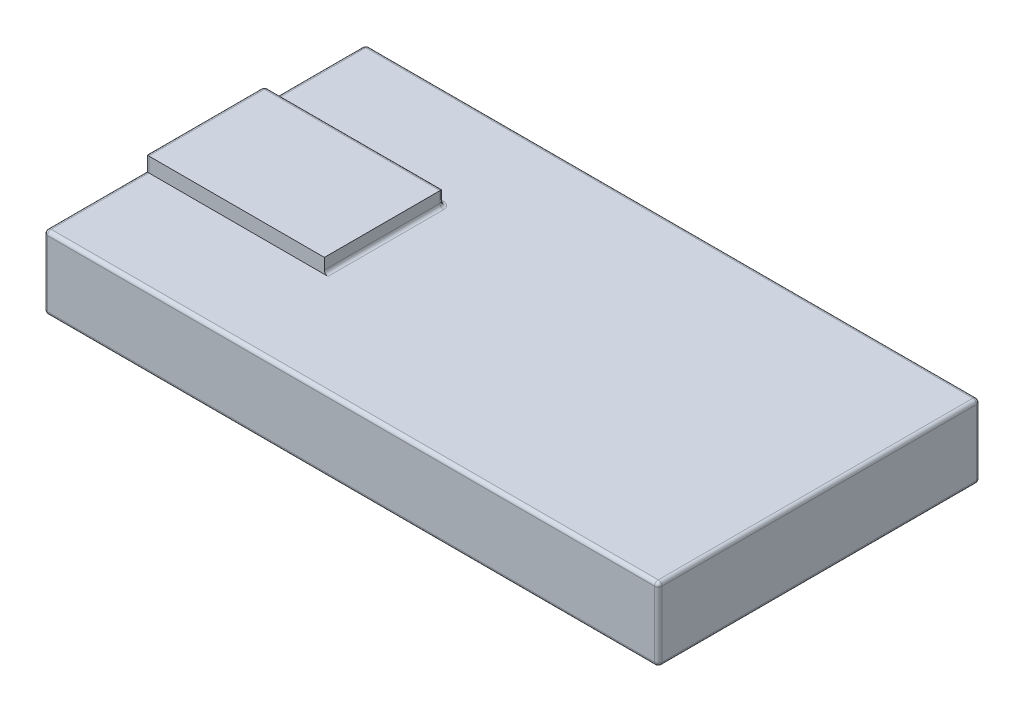
from build123d import *

# Parameters (mm, degrees)
SKETCH_1_W      = 84
SKETCH_1_H      = 44
EXTRUDE_1_DEPTH = 10
SKETCH_3_W      = 24.5
SKETCH_3_H      = 16.3
EXTRUDE_2_DEPTH = 2
FILLET_1_R      = 0.5
FILLET_2_R      = 0.5
FILLET_3_R      = 0.5


with BuildPart() as part:
    # 草图1 → 凸台-拉伸1 (new body)
    with BuildSketch(Plane(origin=(0, 0, 0), x_dir=(1, 0, 0), z_dir=(0, 1, 0))):
        Rectangle(SKETCH_1_W, SKETCH_1_H)
    extrude(amount=EXTRUDE_1_DEPTH)

    # 草图3 → 凸台-拉伸2 (add)
    with BuildSketch(Plane(origin=(0, 10, 0), x_dir=(1, 0, 0), z_dir=(0, 1, 0))):
        with Locations((-29.75, 0)):
            Rectangle(SKETCH_3_W, SKETCH_3_H)
    extrude(amount=EXTRUDE_2_DEPTH)

    # 圆角1
    fillet_1_edges = [part.edges().sort_by_distance(p)[0] for p in [
        (42, 10, 0),
    ]]
    fillet(fillet_1_edges, radius=FILLET_1_R)

    # 圆角2
    fillet_2_edges = [part.edges().sort_by_distance(p)[0] for p in [
        (-0.25, 10, 22),
        (42, 4.75, 22),
        (41.853553391, 9.853553391, 22),
        (0, 0, 22),
    ]]
    fillet(fillet_2_edges, radius=FILLET_2_R)

    # 圆角3
    # the kernel refuses this fillet: 0.5 mm, written as the material it takes off along each edge
    with BuildSketch(Plane(origin=(41.5, 0.5, 21.5), x_dir=(0, -1, 0), z_dir=(1, 0, 0))) as fillet_3_piece_1_section:
        Polygon((0, 0), (FILLET_3_R, 0), (FILLET_3_R, -FILLET_3_R), (0, -FILLET_3_R), align=None)
    fillet_3_piece_1 = extrude(amount=FILLET_3_R, mode=Mode.PRIVATE)
    fillet_3_piece_1 = fillet_3_piece_1 - Plane(origin=(41.5, 0.5, 21.5), x_dir=(0, 0.7071067811865475, -0.7071067811865475), z_dir=(1, 0, 0)) * Sphere(FILLET_3_R, mode=Mode.PRIVATE)
    add(fillet_3_piece_1, mode=Mode.SUBTRACT)
    with BuildSketch(Plane(origin=(41.5, 0.5, -21.5), x_dir=(0, 0, -1), z_dir=(1, 0, 0))) as fillet_3_piece_2_section:
        Polygon((0, 0), (FILLET_3_R, 0), (FILLET_3_R, -FILLET_3_R), (0, -FILLET_3_R), align=None)
    fillet_3_piece_2 = extrude(amount=FILLET_3_R, mode=Mode.PRIVATE)
    fillet_3_piece_2 = fillet_3_piece_2 - Plane(origin=(41.5, 0.5, -21.5), x_dir=(0, 0.7071067811865475, 0.7071067811865475), z_dir=(1, 0, 0)) * Sphere(FILLET_3_R, mode=Mode.PRIVATE)
    add(fillet_3_piece_2, mode=Mode.SUBTRACT)
    with BuildSketch(Plane(origin=(-41.5, 0.5, -21.5), x_dir=(0, 0, -1), z_dir=(-1, 0, 0))) as fillet_3_piece_3_section:
        Polygon((0, 0), (FILLET_3_R, 0), (FILLET_3_R, FILLET_3_R), (0, FILLET_3_R), align=None)
    fillet_3_piece_3 = extrude(amount=FILLET_3_R, mode=Mode.PRIVATE)
    fillet_3_piece_3 = fillet_3_piece_3 - Plane(origin=(-41.5, 0.5, -21.5), x_dir=(0, 0.7071067811865475, 0.7071067811865475), z_dir=(-1, 0, 0)) * Sphere(FILLET_3_R, mode=Mode.PRIVATE)
    add(fillet_3_piece_3, mode=Mode.SUBTRACT)
    with BuildSketch(Plane(origin=(-42, 10, 21.5), x_dir=(1, 0, 0), z_dir=(0, 0, -1))) as fillet_3_piece_4:
        with BuildLine():
            CenterArc((FILLET_3_R, FILLET_3_R), FILLET_3_R, 180, 90)
            Line((0, FILLET_3_R), (0, 0))
            Line((0, 0), (FILLET_3_R, 0))
        make_face()
    extrude(amount=13.35, mode=Mode.SUBTRACT)
    with BuildSketch(Plane(origin=(-42, 10, 8.15), x_dir=(0, 0, -1), z_dir=(0, 1, 0))) as fillet_3_piece_5:
        with BuildLine():
            CenterArc((FILLET_3_R, -FILLET_3_R), FILLET_3_R, 90, 90)
            Line((0, -FILLET_3_R), (0, 0))
            Line((0, 0), (FILLET_3_R, 0))
        make_face()
    extrude(amount=3.25, mode=Mode.SUBTRACT)
    with BuildSketch(Plane(origin=(-17.5, 10, -8.15), x_dir=(-1, 0, 0), z_dir=(0, 1, 0))) as fillet_3_piece_6:
        with BuildLine():
            CenterArc((FILLET_3_R, FILLET_3_R), FILLET_3_R, 180, 90)
            Line((0, FILLET_3_R), (0, 0))
            Line((0, 0), (FILLET_3_R, 0))
        make_face()
    extrude(amount=3.25, mode=Mode.SUBTRACT)
    with BuildSketch(Plane(origin=(-42, 12, -9.4), x_dir=(0, -1, 0), z_dir=(0, 0, 1))) as fillet_3_piece_7:
        with BuildLine():
            CenterArc((FILLET_3_R, FILLET_3_R), FILLET_3_R, 180, 90)
            Line((0, FILLET_3_R), (0, 0))
            Line((0, 0), (FILLET_3_R, 0))
        make_face()
    extrude(amount=18.8, mode=Mode.SUBTRACT)
    with BuildSketch(Plane(origin=(-16.25, 12, -8.15), x_dir=(0, -1, 0), z_dir=(-1, 0, 0))) as fillet_3_piece_8:
        with BuildLine():
            CenterArc((FILLET_3_R, FILLET_3_R), FILLET_3_R, 180, 90)
            Line((0, FILLET_3_R), (0, 0))
            Line((0, 0), (FILLET_3_R, 0))
        make_face()
    extrude(amount=27, mode=Mode.SUBTRACT)
    with BuildSketch(Plane(origin=(-43.25, 10, -22), x_dir=(0, -1, 0), z_dir=(1, 0, 0))) as fillet_3_piece_9:
        with BuildLine():
            CenterArc((FILLET_3_R, -FILLET_3_R), FILLET_3_R, 90, 90)
            Line((0, -FILLET_3_R), (0, 0))
            Line((0, 0), (FILLET_3_R, 0))
        make_face()
    extrude(amount=84.75, mode=Mode.SUBTRACT)
    with BuildSketch(Plane(origin=(42, 0.5, -22), x_dir=(0, 0, 1), z_dir=(0, 1, 0))) as fillet_3_piece_10:
        with BuildLine():
            CenterArc((FILLET_3_R, -FILLET_3_R), FILLET_3_R, 90, 90)
            Line((0, -FILLET_3_R), (0, 0))
            Line((0, 0), (FILLET_3_R, 0))
        make_face()
    extrude(amount=9, mode=Mode.SUBTRACT)
    with BuildSketch(Plane(origin=(41.5, 9.5, -22), x_dir=(1, 0, 0), z_dir=(0, -1, 0))) as fillet_3_piece_11:
        with BuildLine():
            CenterArc((0.5 - FILLET_3_R, FILLET_3_R), FILLET_3_R, 270, 90)
            Line((0.5 - FILLET_3_R, 0), (0.5, 0))
            Line((0.5, 0), (0.5, FILLET_3_R))
        make_face()
    revolve(axis=Axis((41.5, 9.5, -22), (0, 0, 1)), revolution_arc=90, mode=Mode.SUBTRACT)
    with BuildSketch(Plane(origin=(42, 0, -21.5), x_dir=(0, 1, 0), z_dir=(0, 0, 1))) as fillet_3_piece_12:
        with BuildLine():
            CenterArc((FILLET_3_R, FILLET_3_R), FILLET_3_R, 180, 90)
            Line((0, FILLET_3_R), (0, 0))
            Line((0, 0), (FILLET_3_R, 0))
        make_face()
    extrude(amount=43, mode=Mode.SUBTRACT)
    with BuildSketch(Plane(origin=(-42, 0.5, 22), x_dir=(1, 0, 0), z_dir=(0, 1, 0))) as fillet_3_piece_13:
        with BuildLine():
            CenterArc((FILLET_3_R, FILLET_3_R), FILLET_3_R, 180, 90)
            Line((0, FILLET_3_R), (0, 0))
            Line((0, 0), (FILLET_3_R, 0))
        make_face()
    extrude(amount=9, mode=Mode.SUBTRACT)
    with BuildSketch(Plane(origin=(-42, 0.5, 21.5), x_dir=(0, -1, 0), z_dir=(0, 0, -1))) as fillet_3_piece_14:
        with BuildLine():
            CenterArc((0.5 - FILLET_3_R, -FILLET_3_R), FILLET_3_R, 0, 90)
            Line((0.5 - FILLET_3_R, 0), (0.5, 0))
            Line((0.5, 0), (0.5, -FILLET_3_R))
        make_face()
    revolve(axis=Axis((-42, 0.5, 21.5), (-1, 0, 0)), revolution_arc=90, mode=Mode.SUBTRACT)
    with BuildSketch(Plane(origin=(-42, 9.5, 21.5), x_dir=(0, 1, 0), z_dir=(0, 0, -1))) as fillet_3_piece_15:
        with BuildLine():
            CenterArc((0.5 - FILLET_3_R, FILLET_3_R), FILLET_3_R, 270, 90)
            Line((0.5, FILLET_3_R), (0.5, 0))
            Line((0.5, 0), (0.5 - FILLET_3_R, 0))
        make_face()
    revolve(axis=Axis((-42, 9.5, 21.5), (1, 0, 0)), revolution_arc=90, mode=Mode.SUBTRACT)
    with BuildSketch(Plane(origin=(-42, 0, 21.5), x_dir=(1, 0, 0), z_dir=(0, 0, -1))) as fillet_3_piece_16:
        with BuildLine():
            CenterArc((FILLET_3_R, -FILLET_3_R), FILLET_3_R, 90, 90)
            Line((0, -FILLET_3_R), (0, 0))
            Line((0, 0), (FILLET_3_R, 0))
        make_face()
    extrude(amount=43, mode=Mode.SUBTRACT)
    with BuildSketch(Plane(origin=(-41.5, 0, -22), x_dir=(0, 1, 0), z_dir=(1, 0, 0))) as fillet_3_piece_17:
        with BuildLine():
            CenterArc((FILLET_3_R, FILLET_3_R), FILLET_3_R, 180, 90)
            Line((0, FILLET_3_R), (0, 0))
            Line((0, 0), (FILLET_3_R, 0))
        make_face()
    extrude(amount=83, mode=Mode.SUBTRACT)
    with BuildSketch(Plane(origin=(-42, 0.5, -22), x_dir=(1, 0, 0), z_dir=(0, 1, 0))) as fillet_3_piece_18:
        with BuildLine():
            CenterArc((FILLET_3_R, -FILLET_3_R), FILLET_3_R, 90, 90)
            Line((0, -FILLET_3_R), (0, 0))
            Line((0, 0), (FILLET_3_R, 0))
        make_face()
    extrude(amount=10.75, mode=Mode.SUBTRACT)
    with BuildSketch(Plane(origin=(-42, 10, 21.5), x_dir=(1, 0, 0), z_dir=(0, 0, -1))) as fillet_3_piece_19a_section:
        with BuildLine():
            CenterArc((FILLET_3_R, FILLET_3_R), FILLET_3_R, 180, 90)
            Line((0, FILLET_3_R), (0, 0))
            Line((0, 0), (FILLET_3_R, 0))
        make_face()
    fillet_3_piece_19a = extrude(amount=14.6, mode=Mode.PRIVATE)
    fillet_3_piece_19a = split(fillet_3_piece_19a, bisect_by=Plane(origin=(-41.886802443, 9.886802443, 8.15), z_dir=(0, 0, -1)), keep=Keep.TOP, mode=Mode.PRIVATE)
    with BuildSketch(Plane(origin=(-42, 8.75, 8.15), x_dir=(0, 0, -1), z_dir=(0, 1, 0))) as fillet_3_piece_19b_section:
        with BuildLine():
            CenterArc((FILLET_3_R, -FILLET_3_R), FILLET_3_R, 90, 90)
            Line((0, -FILLET_3_R), (0, 0))
            Line((0, 0), (FILLET_3_R, 0))
        make_face()
    fillet_3_piece_19b = extrude(amount=4.5, mode=Mode.PRIVATE)
    fillet_3_piece_19b = split(fillet_3_piece_19b, bisect_by=Plane(origin=(-41.886802443, 10, 8.036802443), z_dir=(0, -1, 0)), keep=Keep.TOP, mode=Mode.PRIVATE)
    fillet_3_piece_19 = fillet_3_piece_19a & fillet_3_piece_19b
    add(fillet_3_piece_19, mode=Mode.SUBTRACT)
    # the kernel refuses this fillet: 0.5 mm, written as the material it adds along each edge
    with BuildSketch(Plane(origin=(-17.5, 10, 8.15), x_dir=(0, 1, 0), z_dir=(0, 0, -1))) as fillet_3_2_piece_1:
        with BuildLine():
            CenterArc((FILLET_3_R, FILLET_3_R), FILLET_3_R, 180, 90)
            Line((0, FILLET_3_R), (0, 0))
            Line((0, 0), (FILLET_3_R, 0))
        make_face()
    extrude(amount=15.8)
    with BuildSketch(Plane(origin=(-18, 10, -8.15), x_dir=(0, 1, 0), z_dir=(-1, 0, 0))) as fillet_3_2_piece_2:
        with BuildLine():
            CenterArc((FILLET_3_R, FILLET_3_R), FILLET_3_R, 180, 90)
            Line((0, FILLET_3_R), (0, 0))
            Line((0, 0), (FILLET_3_R, 0))
        make_face()
    extrude(amount=24)
    with BuildSketch(Plane(origin=(-18, 10, -7.65), x_dir=(0, 0, -1), z_dir=(-1, 0, 0))) as fillet_3_2_piece_3:
        with BuildLine():
            CenterArc((0.5 + FILLET_3_R, -FILLET_3_R), FILLET_3_R, 90, 90)
            Line((0.5 + FILLET_3_R, 0), (0.5, 0))
            Line((0.5, 0), (0.5, -FILLET_3_R))
        make_face()
    revolve(axis=Axis((-18, 10, -7.65), (0, -1, 0)), revolution_arc=90)
    # the kernel refuses this fillet: 0.5 mm, written as the material it takes off along each edge
    with BuildSketch(Plane(origin=(-41.5, 11.5, -7.65), x_dir=(-1, 0, 0), z_dir=(0, 0, -1))) as fillet_3_3_piece_1_section:
        Polygon((0, 0), (FILLET_3_R, 0), (FILLET_3_R, FILLET_3_R), (0, FILLET_3_R), align=None)
    fillet_3_3_piece_1 = extrude(amount=FILLET_3_R, mode=Mode.PRIVATE)
    fillet_3_3_piece_1 = fillet_3_3_piece_1 - Plane(origin=(-41.5, 11.5, -7.65), x_dir=(0.7071067811865475, -0.7071067811865475, 0), z_dir=(0, 0, -1)) * Sphere(FILLET_3_R, mode=Mode.PRIVATE)
    add(fillet_3_3_piece_1, mode=Mode.SUBTRACT)
    with BuildSketch(Plane(origin=(-41.5, 9.5, -21.5), x_dir=(0, 1, 0), z_dir=(-1, 0, 0))) as fillet_3_3_piece_2_section:
        Polygon((0, 0), (FILLET_3_R, 0), (FILLET_3_R, FILLET_3_R), (0, FILLET_3_R), align=None)
    fillet_3_3_piece_2 = extrude(amount=FILLET_3_R, mode=Mode.PRIVATE)
    fillet_3_3_piece_2 = fillet_3_3_piece_2 - Plane(origin=(-41.5, 9.5, -21.5), x_dir=(0, -0.7071067811865475, 0.7071067811865475), z_dir=(-1, 0, 0)) * Sphere(FILLET_3_R, mode=Mode.PRIVATE)
    add(fillet_3_3_piece_2, mode=Mode.SUBTRACT)
    with BuildSketch(Plane(origin=(-42, 10, -8.65), x_dir=(0, -1, 0), z_dir=(0, 0, -1))) as fillet_3_3_piece_3:
        with BuildLine():
            CenterArc((FILLET_3_R, -FILLET_3_R), FILLET_3_R, 90, 90)
            Line((0, -FILLET_3_R), (0, 0))
            Line((0, 0), (FILLET_3_R, 0))
        make_face()
    extrude(amount=12.85, mode=Mode.SUBTRACT)
    with BuildSketch(Plane(origin=(-42, 10.5, -8.15), x_dir=(1, 0, 0), z_dir=(0, 1, 0))) as fillet_3_3_piece_4:
        with BuildLine():
            CenterArc((FILLET_3_R, -FILLET_3_R), FILLET_3_R, 90, 90)
            Line((0, -FILLET_3_R), (0, 0))
            Line((0, 0), (FILLET_3_R, 0))
        make_face()
    extrude(amount=1, mode=Mode.SUBTRACT)
    with BuildSketch(Plane(origin=(-42, 10.5, -8.65), x_dir=(0, 0, 1), z_dir=(0, 1, 0))) as fillet_3_3_piece_5:
        with BuildLine():
            CenterArc((0.5 + FILLET_3_R, FILLET_3_R), FILLET_3_R, 180, 90)
            Line((0.5 + FILLET_3_R, 0), (0.5, 0))
            Line((0.5, 0), (0.5, FILLET_3_R))
        make_face()
    revolve(axis=Axis((-42, 10.5, -8.65), (1, 0, 0)), revolution_arc=90, mode=Mode.SUBTRACT)


solid = part.part
